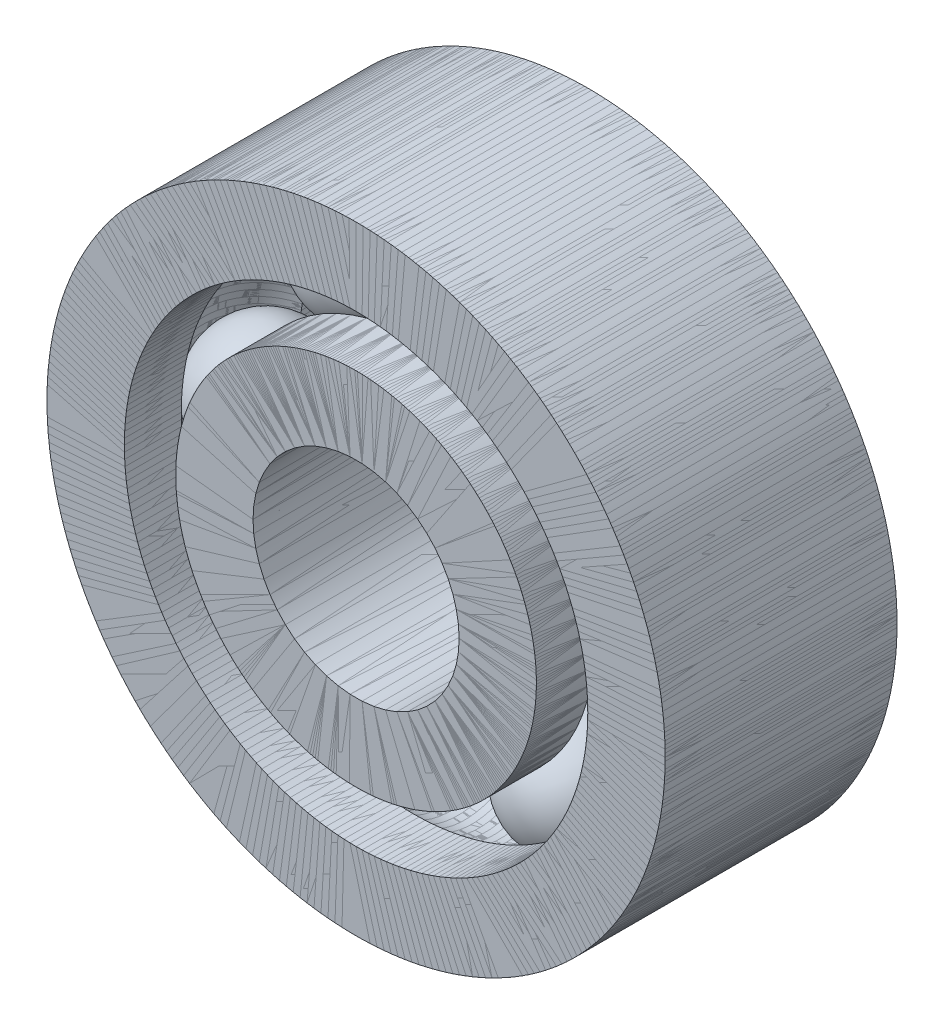
from build123d import *

# Parameters (mm, degrees)
SKETCH1_R           = 6
SKETCH1_R_2         = 4.5
BOSS_EXTRUDE1_DEPTH = 4.5
SKETCH4_R           = 3.5
SKETCH4_R_2         = 2
BOSS_EXTRUDE3_DEPTH = 4.5
CIRPATTERN9_COUNT   = 6


# Read off the part's stored shape, not the designer's step: Cut-Sweep1
with BuildPart() as part:
    # Sketch1 → Boss-Extrude1 (new body)
    with BuildSketch(Plane.XY):
        Circle(SKETCH1_R)
        Circle(SKETCH1_R_2, mode=Mode.SUBTRACT)
    extrude(amount=BOSS_EXTRUDE1_DEPTH)


with BuildPart() as body_2:
    # Sketch4 → Boss-Extrude3 (new body)
    with BuildSketch(Plane.XY):
        Circle(SKETCH4_R)
        Circle(SKETCH4_R_2, mode=Mode.SUBTRACT)
    extrude(amount=BOSS_EXTRUDE3_DEPTH)


with BuildPart() as cut_sweep1_tool:
    # Cut-Sweep1 outline → Cut-Sweep1 (revolve)
    with BuildSketch(Plane.XZ):
        with BuildLine():
            ThreePointArc((3.5, 3.395643924), (2.75, 2.25), (3.5, 1.104356076))
            Line((3.5, 1.104356076), (4.5, 1.104356076))
            ThreePointArc((4.5, 1.104356076), (5.25, 2.25), (4.5, 3.395643924))
            Line((4.5, 3.395643924), (3.5, 3.395643924))
        make_face()
    revolve(axis=Axis((0, 0, 0), (0, 0, 1)))


with BuildPart() as part_1:
    add(part.part)

    # Cut-Sweep1: cut by cut_sweep1_tool
    add(cut_sweep1_tool.part, mode=Mode.SUBTRACT)


with BuildPart() as body_2_1:
    add(body_2.part)

    # Cut-Sweep1: cut by cut_sweep1_tool
    add(cut_sweep1_tool.part, mode=Mode.SUBTRACT)


with BuildPart() as body_3:
    # Sketch6 → Revolve2 (revolve)
    with BuildSketch(Plane(origin=(0, 0, 0), x_dir=(1, 0, 0), z_dir=(0, 1, 0))):
        with BuildLine():
            Line((-5.2, -2.25), (-2.8, -2.25))
            ThreePointArc((-2.8, -2.25), (-4, -1.05), (-5.2, -2.25))
        make_face()
    revolve(axis=Axis((-5.2, 0, 2.25), (1, 0, 0)))


with BuildPart() as cirpattern9_1:
    # CirPattern9: pattern copy
    add(part_1.part.rotate(Axis((0, 0, 0), (0, 0, 1)), 1 * 360 / CIRPATTERN9_COUNT))


with BuildPart() as cirpattern9_2:
    # CirPattern9: pattern copy
    add(part_1.part.rotate(Axis((0, 0, 0), (0, 0, 1)), 2 * 360 / CIRPATTERN9_COUNT))


with BuildPart() as cirpattern9_3:
    # CirPattern9: pattern copy
    add(part_1.part.rotate(Axis((0, 0, 0), (0, 0, 1)), 3 * 360 / CIRPATTERN9_COUNT))


with BuildPart() as cirpattern9_4:
    # CirPattern9: pattern copy
    add(part_1.part.rotate(Axis((0, 0, 0), (0, 0, 1)), 4 * 360 / CIRPATTERN9_COUNT))


with BuildPart() as cirpattern9_5:
    # CirPattern9: pattern copy
    add(part_1.part.rotate(Axis((0, 0, 0), (0, 0, 1)), 5 * 360 / CIRPATTERN9_COUNT))


with BuildPart() as cirpattern9_6:
    # CirPattern9: pattern copy
    add(body_2_1.part.rotate(Axis((0, 0, 0), (0, 0, 1)), 1 * 360 / CIRPATTERN9_COUNT))


with BuildPart() as cirpattern9_7:
    # CirPattern9: pattern copy
    add(body_2_1.part.rotate(Axis((0, 0, 0), (0, 0, 1)), 2 * 360 / CIRPATTERN9_COUNT))


with BuildPart() as cirpattern9_8:
    # CirPattern9: pattern copy
    add(body_2_1.part.rotate(Axis((0, 0, 0), (0, 0, 1)), 3 * 360 / CIRPATTERN9_COUNT))


with BuildPart() as cirpattern9_9:
    # CirPattern9: pattern copy
    add(body_2_1.part.rotate(Axis((0, 0, 0), (0, 0, 1)), 4 * 360 / CIRPATTERN9_COUNT))


with BuildPart() as cirpattern9_10:
    # CirPattern9: pattern copy
    add(body_2_1.part.rotate(Axis((0, 0, 0), (0, 0, 1)), 5 * 360 / CIRPATTERN9_COUNT))


with BuildPart() as cirpattern9_11:
    # CirPattern9: pattern copy
    add(body_3.part.rotate(Axis((0, 0, 0), (0, 0, 1)), 1 * 360 / CIRPATTERN9_COUNT))


with BuildPart() as cirpattern9_12:
    # CirPattern9: pattern copy
    add(body_3.part.rotate(Axis((0, 0, 0), (0, 0, 1)), 2 * 360 / CIRPATTERN9_COUNT))


with BuildPart() as cirpattern9_13:
    # CirPattern9: pattern copy
    add(body_3.part.rotate(Axis((0, 0, 0), (0, 0, 1)), 3 * 360 / CIRPATTERN9_COUNT))


with BuildPart() as cirpattern9_14:
    # CirPattern9: pattern copy
    add(body_3.part.rotate(Axis((0, 0, 0), (0, 0, 1)), 4 * 360 / CIRPATTERN9_COUNT))


with BuildPart() as cirpattern9_15:
    # CirPattern9: pattern copy
    add(body_3.part.rotate(Axis((0, 0, 0), (0, 0, 1)), 5 * 360 / CIRPATTERN9_COUNT))


solid = Compound([part_1.part, body_2_1.part, body_3.part, cirpattern9_1.part, cirpattern9_2.part, cirpattern9_3.part, cirpattern9_4.part, cirpattern9_5.part, cirpattern9_6.part, cirpattern9_7.part, cirpattern9_8.part, cirpattern9_9.part, cirpattern9_10.part, cirpattern9_11.part, cirpattern9_12.part, cirpattern9_13.part, cirpattern9_14.part, cirpattern9_15.part])
